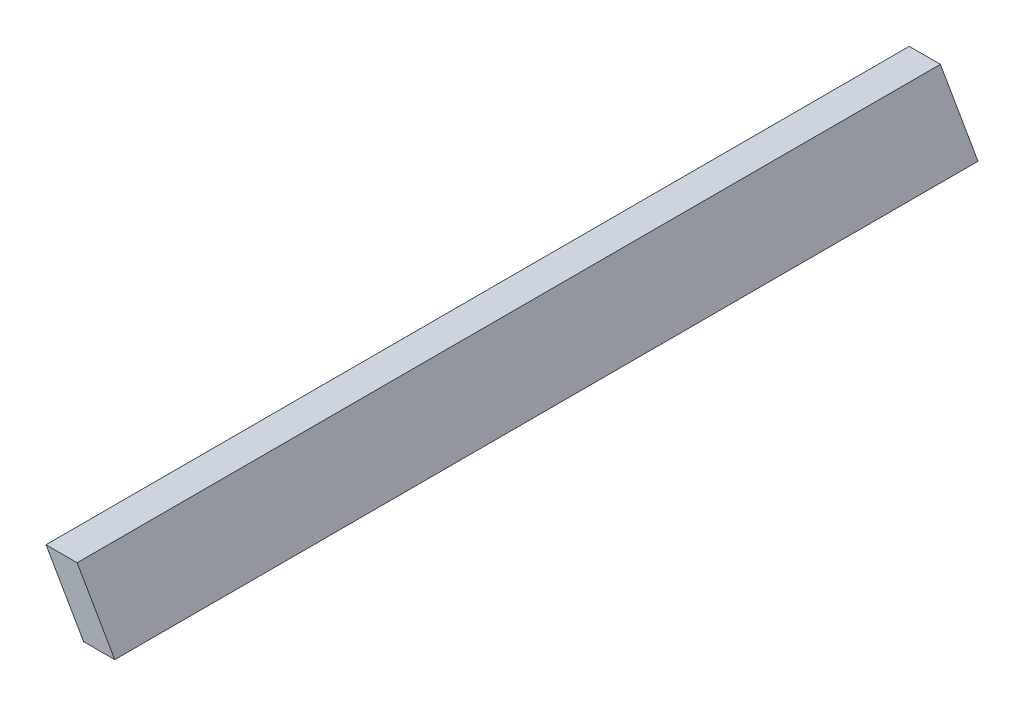
from build123d import *

# Parameters (mm, degrees)
BOSS_EXTRUDE1_DEPTH = 203.2
CUT_EXTRUDE1_DEPTH  = 7.112


with BuildPart() as part:
    # end-profile → Boss-Extrude1 (new body)
    with BuildSketch(Plane.XY):
        Polygon((-8.872141587, 15.367), (-16.204490005, 15.367), (-7.35048161, 0.031407609), (-0.018133191, 0.031407609), align=None)
    extrude(amount=BOSS_EXTRUDE1_DEPTH)

    # Sketch4 → Cut-Extrude1 (cut)
    with BuildSketch(Plane(origin=(-16.204490005, 0, 0), x_dir=(0, 0, -1), z_dir=(1, 0, 0))):
        with BuildLine():
            Line((-181.18709, 7.699203804), (-181.18709, 0.031407609))
            Line((-181.18709, 0.031407609), (-174.41291, 0.031407609))
            Line((-174.41291, 0.031407609), (-174.41291, 7.699203804))
            ThreePointArc((-174.41291, 7.699203804), (-177.8, 11.086293804), (-181.18709, 7.699203804))
        make_face()
        with BuildLine():
            Line((-143.08709, 7.699203804), (-143.08709, 0.031407609))
            Line((-143.08709, 0.031407609), (-136.31291, 0.031407609))
            Line((-136.31291, 0.031407609), (-136.31291, 7.699203804))
            ThreePointArc((-136.31291, 7.699203804), (-139.7, 11.086293804), (-143.08709, 7.699203804))
        make_face()
        with BuildLine():
            Line((-104.98709, 7.699203804), (-104.98709, 0.031407609))
            Line((-104.98709, 0.031407609), (-98.21291, 0.031407609))
            Line((-98.21291, 0.031407609), (-98.21291, 7.699203804))
            ThreePointArc((-98.21291, 7.699203804), (-101.6, 11.086293804), (-104.98709, 7.699203804))
        make_face()
        with BuildLine():
            Line((-66.88709, 7.699203804), (-66.88709, 0.031407609))
            Line((-66.88709, 0.031407609), (-60.11291, 0.031407609))
            Line((-60.11291, 0.031407609), (-60.11291, 7.699203804))
            ThreePointArc((-60.11291, 7.699203804), (-63.5, 11.086293804), (-66.88709, 7.699203804))
        make_face()
        with BuildLine():
            Line((-28.78709, 7.699203804), (-28.78709, 0.031407609))
            Line((-28.78709, 0.031407609), (-22.01291, 0.031407609))
            Line((-22.01291, 0.031407609), (-22.01291, 7.699203804))
            ThreePointArc((-22.01291, 7.699203804), (-25.4, 11.086293804), (-28.78709, 7.699203804))
        make_face()
    extrude(amount=CUT_EXTRUDE1_DEPTH, mode=Mode.SUBTRACT)


solid = part.part
